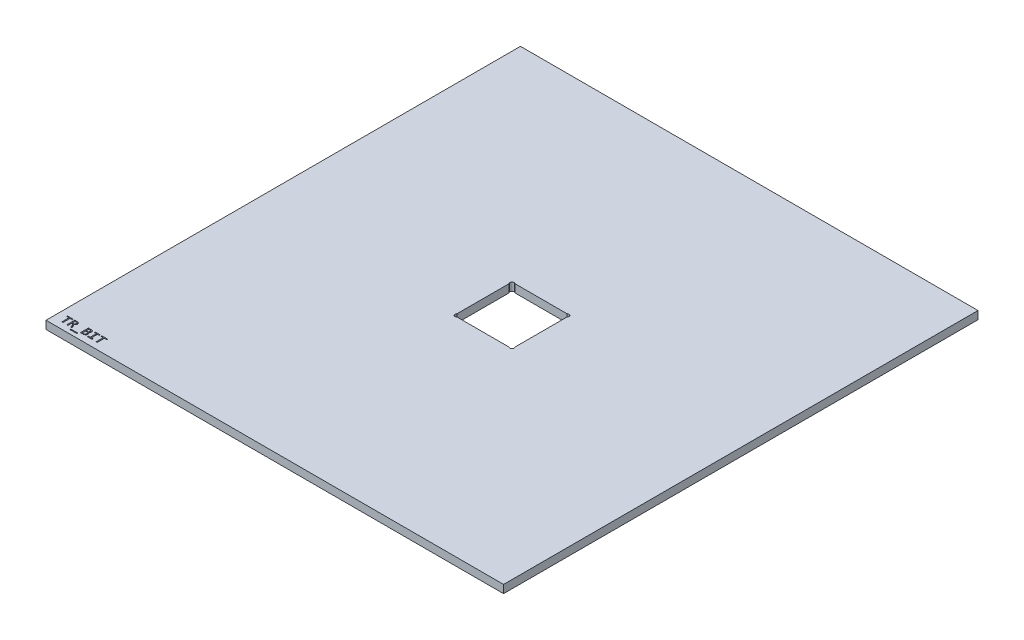
from build123d import *

# Parameters (mm, degrees)
SKETCH1_W           = 180.848
SKETCH1_H           = 187.5155
BOSS_EXTRUDE1_DEPTH = 3.175
SKETCH2_W           = 22.86
SKETCH2_H           = 22.86
CUT_EXTRUDE1_DEPTH  = 3.175
SKETCH3_R           = 0.79375
CUT_EXTRUDE2_DEPTH  = 131.296186
SKETCH4_W           = 2.714855072
SKETCH4_H           = 0.368115942
CUT_EXTRUDE3_DEPTH  = 1.5875


with BuildPart() as part:
    # Sketch1 → Boss-Extrude1 (new body)
    with BuildSketch(Plane(origin=(0, 0, 0), x_dir=(1, 0, 0), z_dir=(0, 1, 0))):
        Rectangle(SKETCH1_W, SKETCH1_H)
    extrude(amount=BOSS_EXTRUDE1_DEPTH)

    # Sketch2 → Cut-Extrude1 (cut)
    with BuildSketch(Plane(origin=(0, 3.175, 0), x_dir=(1, 0, 0), z_dir=(0, 1, 0))):
        Rectangle(SKETCH2_W, SKETCH2_H)
    extrude(amount=-CUT_EXTRUDE1_DEPTH, mode=Mode.SUBTRACT)

    # Sketch3 → Cut-Extrude2 (cut, through all)
    with BuildSketch(Plane(origin=(0, 3.175, 0), x_dir=(1, 0, 0), z_dir=(0, 1, 0))):
        with Locations((-10.868733992, 10.868733992)):
            Circle(SKETCH3_R)
        with Locations((10.868733992, 10.868733992)):
            Circle(SKETCH3_R)
        with Locations((10.868733992, -10.868733992)):
            Circle(SKETCH3_R)
        with Locations((-10.868733992, -10.868733992)):
            Circle(SKETCH3_R)
    extrude(amount=-CUT_EXTRUDE2_DEPTH, mode=Mode.SUBTRACT)

    # Sketch4 → Cut-Extrude3 (cut)
    # profile 1 of 6: a face of its own
    with BuildSketch(Plane(origin=(0, 3.175, 0), x_dir=(1, 0, 0), z_dir=(0, 1, 0))):
        Polygon((-85.353202899, -88.410865942), (-86.273492754, -88.410865942), (-86.273492754, -91.21775), (-86.733637681, -91.21775), (-86.733637681, -88.410865942), (-87.653927536, -88.410865942), (-87.653927536, -88.04275), (-85.353202899, -88.04275), align=None)
    # profile 2 of 6: a face of its own
    with BuildSketch(Plane(origin=(0, 3.175, 0), x_dir=(1, 0, 0), z_dir=(0, 1, 0))):
        with BuildLine():
            Line((-82.638347826, -91.21775), (-83.125813859, -91.21775))
            Line((-83.125813859, -91.21775), (-83.582363904, -90.226281476))
            add(Edge.make_bspline(
                [(-83.582363904, -90.226281476), (-83.598860974, -90.191130284), (-83.629465089, -90.125920458), (-83.683350175, -90.040294449), (-83.73916016, -89.971305876), (-83.799615044, -89.918268069), (-83.865569382, -89.879574558), (-83.937441008, -89.854540538), (-84.016272547, -89.839988328), (-84.071201483, -89.838235213), (-84.100026947, -89.837315217)],
                knots=[0, 0, 0, 0, 1.339134837, 2.484261414, 3.482991323, 4.391871607, 5.244507385, 6.105289549, 7.005698766, 8, 8, 8, 8], degree=3))
            Line((-84.100026947, -89.837315217), (-84.294869565, -89.837315217))
            Line((-84.294869565, -89.837315217), (-84.294869565, -91.21775))
            Line((-84.294869565, -91.21775), (-84.755014493, -91.21775))
            Line((-84.755014493, -91.21775), (-84.755014493, -88.04275))
            Line((-84.755014493, -88.04275), (-83.910936141, -88.04275))
            add(Edge.make_bspline(
                [(-83.910936141, -88.04275), (-83.866571096, -88.043324801), (-83.781034279, -88.044433032), (-83.657527264, -88.056115686), (-83.543677978, -88.074962175), (-83.439661951, -88.102534986), (-83.344774287, -88.136226928), (-83.258689811, -88.176489474), (-83.181396775, -88.223089264), (-83.113190469, -88.276260019), (-83.052893824, -88.334285294), (-83.002293397, -88.399280748), (-82.959385051, -88.469287391), (-82.925710385, -88.545372647), (-82.900177177, -88.626034235), (-82.88111807, -88.710889782), (-82.870477515, -88.800037309), (-82.869113537, -88.860918232), (-82.86842029, -88.891861187)],
                knots=[0, 0, 0, 0, 1.390037284, 2.680023546, 3.883960013, 5.002565466, 6.047913656, 7.03574216, 7.976084698, 8.870016629, 9.741095147, 10.591561451, 11.444313202, 12.308368875, 13.191986167, 14.092206828, 15.030357037, 16, 16, 16, 16], degree=3))
            add(Edge.make_bspline(
                [(-82.86842029, -88.891861187), (-82.868994868, -88.916809205), (-82.870124847, -88.965872567), (-82.878430329, -89.038414802), (-82.89100624, -89.108963136), (-82.909849703, -89.177190844), (-82.933612198, -89.242831971), (-82.962310371, -89.305834559), (-82.997136135, -89.36550299), (-83.036557213, -89.422458811), (-83.081411438, -89.475782218), (-83.130948802, -89.525652899), (-83.18635394, -89.570899919), (-83.245486917, -89.613413484), (-83.309965112, -89.651029424), (-83.379136935, -89.683170015), (-83.452650391, -89.710818718), (-83.503864807, -89.724616993), (-83.529878623, -89.731625679)],
                knots=[0, 0, 0, 0, 1.032708305, 2.030948508, 3.019625047, 3.996933367, 4.957424013, 5.907556856, 6.85893238, 7.814077788, 8.77200233, 9.740252168, 10.719774328, 11.730219428, 12.753012585, 13.805036997, 14.885091985, 16, 16, 16, 16], degree=3))
            add(Edge.make_bspline(
                [(-83.529878623, -89.731625679), (-83.508734767, -89.739380778), (-83.466783942, -89.754767413), (-83.409104807, -89.789031767), (-83.354855427, -89.828859176), (-83.307413111, -89.879758478), (-83.261027139, -89.937088784), (-83.215047309, -90.003148469), (-83.168355492, -90.077696238), (-83.138952467, -90.131452504), (-83.123656929, -90.159416667)],
                knots=[0, 0, 0, 0, 0.890820497, 1.767447404, 2.649001527, 3.549193506, 4.515009134, 5.571837998, 6.736863216, 8, 8, 8, 8], degree=3))
            Line((-83.123656929, -90.159416667), (-82.638347826, -91.21775))
        make_face()
        with BuildLine():
            add(Edge.make_bspline(
                [(-83.328565217, -88.922777174), (-83.328901843, -88.901906114), (-83.32955407, -88.861467484), (-83.336773162, -88.802931226), (-83.34912625, -88.74858325), (-83.365581675, -88.698221992), (-83.386140981, -88.651372969), (-83.413407518, -88.609650848), (-83.444183923, -88.571263632), (-83.479733549, -88.537216471), (-83.519769509, -88.507597987), (-83.563758214, -88.481855754), (-83.611291845, -88.459414038), (-83.662835579, -88.441302724), (-83.718322956, -88.428061778), (-83.777599298, -88.41773837), (-83.840852671, -88.41224996), (-83.884324813, -88.411335157), (-83.906622283, -88.410865942)],
                knots=[0, 0, 0, 0, 1.136086502, 2.201219443, 3.204852043, 4.166451082, 5.083443327, 5.98129036, 6.87199526, 7.758098985, 8.653381414, 9.577773354, 10.529401831, 11.511765708, 12.546811162, 13.632454437, 14.78565276, 16, 16, 16, 16], degree=3))
            Line((-83.906622283, -88.410865942), (-84.294869565, -88.410865942))
            Line((-84.294869565, -88.410865942), (-84.294869565, -89.469199275))
            Line((-84.294869565, -89.469199275), (-83.961983469, -89.469199275))
            add(Edge.make_bspline(
                [(-83.961983469, -89.469199275), (-83.93824743, -89.468775061), (-83.891881464, -89.467946402), (-83.824245057, -89.461800526), (-83.760525642, -89.449675605), (-83.700090994, -89.435336816), (-83.643820366, -89.415000628), (-83.592001738, -89.390397511), (-83.543763099, -89.362541635), (-83.500833591, -89.329095915), (-83.461473321, -89.292318472), (-83.427024794, -89.251260372), (-83.397057325, -89.206291797), (-83.372862702, -89.156799379), (-83.3522013, -89.103890377), (-83.339197548, -89.046440031), (-83.330033673, -88.985862033), (-83.329062587, -88.944144192), (-83.328565217, -88.922777174)],
                knots=[0, 0, 0, 0, 1.202615583, 2.349188572, 3.435207305, 4.486530095, 5.492783739, 6.45958443, 7.390413995, 8.308405015, 9.210274755, 10.115082188, 11.017605575, 11.940721498, 12.901403136, 13.887978084, 14.918265918, 16, 16, 16, 16], degree=3))
        make_face(mode=Mode.SUBTRACT)
    # profile 3 of 6: a face of its own
    with BuildSketch(Plane(origin=(0, 3.175, 0), x_dir=(1, 0, 0), z_dir=(0, 1, 0))):
        with Locations((-81.096862319, -92.04601087)):
            Rectangle(SKETCH4_W, SKETCH4_H)
    # profile 4 of 6: a face of its own
    with BuildSketch(Plane(origin=(0, 3.175, 0), x_dir=(1, 0, 0), z_dir=(0, 1, 0))):
        with BuildLine():
            add(Edge.make_bspline(
                [(-77.300666667, -90.256478487), (-77.301767408, -90.293929266), (-77.303916628, -90.367052676), (-77.320759558, -90.473189263), (-77.348005833, -90.573001284), (-77.38692422, -90.665931999), (-77.43648218, -90.751801926), (-77.493981353, -90.831853883), (-77.562241143, -90.903949147), (-77.6396186, -90.968793102), (-77.725718864, -91.026528496), (-77.820300053, -91.076706576), (-77.923229564, -91.120132703), (-78.034429642, -91.155730594), (-78.15300213, -91.183451777), (-78.278120993, -91.203821947), (-78.409843128, -91.214989694), (-78.49989964, -91.216816295), (-78.545933877, -91.21775)],
                knots=[0, 0, 0, 0, 1.013216857, 1.978326566, 2.900521816, 3.80762901, 4.696652207, 5.578905641, 6.469134838, 7.376056482, 8.306156408, 9.269586241, 10.269510869, 11.325927403, 12.425683058, 13.562442612, 14.753992443, 16, 16, 16, 16], degree=3))
            Line((-78.545933877, -91.21775), (-79.371318841, -91.21775))
            Line((-79.371318841, -91.21775), (-79.371318841, -88.04275))
            Line((-79.371318841, -88.04275), (-78.458937726, -88.04275))
            add(Edge.make_bspline(
                [(-78.458937726, -88.04275), (-78.415776923, -88.043171305), (-78.332222251, -88.043986906), (-78.211327188, -88.05393778), (-78.098609009, -88.067679445), (-77.994182637, -88.088203549), (-77.898285108, -88.115948787), (-77.809991763, -88.147610533), (-77.730514356, -88.186599133), (-77.659442607, -88.23147315), (-77.596067661, -88.28174973), (-77.541935424, -88.339261014), (-77.495367382, -88.402028876), (-77.457743947, -88.471343702), (-77.428163159, -88.546400313), (-77.407445232, -88.627549956), (-77.395186792, -88.714378614), (-77.393541304, -88.774148172), (-77.392695652, -88.804865036)],
                knots=[0, 0, 0, 0, 1.388776146, 2.688521212, 3.90167895, 5.042289038, 6.109239049, 7.11226345, 8.057476407, 8.951978552, 9.813306123, 10.653548746, 11.486644475, 12.322022467, 13.184316581, 14.076721024, 15.011585489, 16, 16, 16, 16], degree=3))
            add(Edge.make_bspline(
                [(-77.392695652, -88.804865036), (-77.394187829, -88.845716953), (-77.397092057, -88.925227163), (-77.420465455, -89.040231165), (-77.459482567, -89.146199347), (-77.504703675, -89.227097931), (-77.548888272, -89.286037834), (-77.587262923, -89.327182959), (-77.63058913, -89.365156859), (-77.678325997, -89.400685977), (-77.731080807, -89.433021183), (-77.788816355, -89.462453202), (-77.851312239, -89.489051092), (-77.895156559, -89.503989589), (-77.91754846, -89.511618886)],
                knots=[0, 0, 0, 0, 1.542514348, 3.00220039, 4.41170875, 5.794260582, 6.486040375, 7.190794555, 7.915677968, 8.659981338, 9.436469499, 10.250434215, 11.106472525, 12, 12, 12, 12], degree=3))
            add(Edge.make_bspline(
                [(-77.91754846, -89.511618886), (-77.87664368, -89.52138252), (-77.794952297, -89.540881581), (-77.69877587, -89.584147488), (-77.626119669, -89.625464199), (-77.575453465, -89.662078725), (-77.52784107, -89.702208006), (-77.483872937, -89.7470422), (-77.44350785, -89.795968992), (-77.407265864, -89.849224875), (-77.376677228, -89.907458977), (-77.348810265, -89.96901986), (-77.327568021, -90.035403794), (-77.311528408, -90.105578127), (-77.302101832, -90.179769245), (-77.30115142, -90.230568553), (-77.300666667, -90.256478487)],
                knots=[0, 0, 0, 0, 1.670885493, 3.336943679, 4.174711656, 4.995358125, 5.821090152, 6.65083528, 7.491206374, 8.34319308, 9.209637874, 10.10658404, 11.029731221, 11.978595832, 12.968992875, 14, 14, 14, 14], degree=3))
        make_face()
        with BuildLine():
            add(Edge.make_bspline(
                [(-77.85284058, -88.864540082), (-77.854161122, -88.833734621), (-77.856753897, -88.773250649), (-77.875402457, -88.700093166), (-77.897242037, -88.645331886), (-77.919347424, -88.60738698), (-77.947588932, -88.572860108), (-77.980772524, -88.541382551), (-78.019214895, -88.512019396), (-78.064494712, -88.487086054), (-78.115808229, -88.464860097), (-78.173491667, -88.445492372), (-78.238113978, -88.42957659), (-78.31047592, -88.41815795), (-78.390767081, -88.41204341), (-78.446944803, -88.411269086), (-78.476193161, -88.410865942)],
                knots=[0, 0, 0, 0, 1.467350645, 2.88102155, 3.572915596, 4.274650825, 4.965411238, 5.692918483, 6.45179769, 7.26549663, 8.150919223, 9.115896111, 10.16367939, 11.321101063, 12.605258578, 14, 14, 14, 14], degree=3))
            Line((-78.476193161, -88.410865942), (-78.911173913, -88.410865942))
            Line((-78.911173913, -88.410865942), (-78.911173913, -89.37717029))
            Line((-78.911173913, -89.37717029), (-78.49057269, -89.37717029))
            add(Edge.make_bspline(
                [(-78.49057269, -89.37717029), (-78.444696492, -89.375694942), (-78.356911508, -89.372871835), (-78.250692628, -89.35378391), (-78.173249825, -89.331332692), (-78.121468475, -89.308054353), (-78.072480474, -89.283616777), (-78.028835265, -89.252923081), (-77.988728878, -89.219097156), (-77.953534545, -89.180905973), (-77.92287595, -89.138813833), (-77.897680681, -89.092359062), (-77.877342165, -89.041771711), (-77.863140955, -88.986682116), (-77.854316788, -88.927136465), (-77.853344367, -88.885902411), (-77.85284058, -88.864540082)],
                knots=[0, 0, 0, 0, 2.073538655, 3.967755928, 4.862618563, 5.712230629, 6.531505899, 7.334196252, 8.118305519, 8.900614993, 9.67674368, 10.467342855, 11.284464589, 12.136217, 13.034420764, 14, 14, 14, 14], degree=3))
        make_face(mode=Mode.SUBTRACT)
        with BuildLine():
            add(Edge.make_bspline(
                [(-77.760811594, -90.273014946), (-77.761288763, -90.253085269), (-77.762225678, -90.213953551), (-77.771847595, -90.156726005), (-77.78761894, -90.102682223), (-77.809520058, -90.051850198), (-77.836570675, -90.004209361), (-77.870248318, -89.960957686), (-77.90863738, -89.92069802), (-77.953307965, -89.885006521), (-78.00326612, -89.853546666), (-78.057735842, -89.825120785), (-78.117411303, -89.80079497), (-78.182173689, -89.780869375), (-78.251622709, -89.764982077), (-78.325406869, -89.753843571), (-78.403656965, -89.746206424), (-78.457240624, -89.745598922), (-78.484820879, -89.745286232)],
                knots=[0, 0, 0, 0, 0.948445084, 1.862262358, 2.754366203, 3.623615494, 4.492864785, 5.355796555, 6.227589923, 7.136690505, 8.070741307, 9.035595869, 10.059344591, 11.135152229, 12.259281394, 13.44900263, 14.686966176, 16, 16, 16, 16], degree=3))
            Line((-78.484820879, -89.745286232), (-78.911173913, -89.745286232))
            Line((-78.911173913, -89.745286232), (-78.911173913, -90.849634058))
            Line((-78.911173913, -90.849634058), (-78.47044135, -90.849634058))
            add(Edge.make_bspline(
                [(-78.47044135, -90.849634058), (-78.441427747, -90.849264013), (-78.385480287, -90.848550449), (-78.304349458, -90.84185132), (-78.228786402, -90.831613893), (-78.159194988, -90.815617802), (-78.095172075, -90.79622008), (-78.036524019, -90.772887579), (-77.984110327, -90.74375948), (-77.936450768, -90.711542959), (-77.895152566, -90.673498072), (-77.858799326, -90.63098716), (-77.828566956, -90.582834844), (-77.803342481, -90.530299179), (-77.783834378, -90.472855434), (-77.770317732, -90.410634095), (-77.762520159, -90.343433535), (-77.761393583, -90.297001648), (-77.760811594, -90.273014946)],
                knots=[0, 0, 0, 0, 1.326701194, 2.558302104, 3.720902774, 4.811133236, 5.820090824, 6.778795896, 7.691204955, 8.557756331, 9.403467856, 10.251165954, 11.10865784, 11.996033528, 12.91113804, 13.8765245, 14.903013039, 16, 16, 16, 16], degree=3))
        make_face(mode=Mode.SUBTRACT)
    # profile 5 of 6: a face of its own
    with BuildSketch(Plane(origin=(0, 3.175, 0), x_dir=(1, 0, 0), z_dir=(0, 1, 0))):
        Polygon((-75.874217391, -88.410865942), (-76.610449275, -88.410865942), (-76.610449275, -88.04275), (-74.67784058, -88.04275), (-74.67784058, -88.410865942), (-75.414072464, -88.410865942), (-75.414072464, -90.849634058), (-74.67784058, -90.849634058), (-74.67784058, -91.21775), (-76.610449275, -91.21775), (-76.610449275, -90.849634058), (-75.874217391, -90.849634058), align=None)
    # profile 6 of 6: a face of its own
    with BuildSketch(Plane(origin=(0, 3.175, 0), x_dir=(1, 0, 0), z_dir=(0, 1, 0))):
        Polygon((-71.778927536, -88.410865942), (-72.699217391, -88.410865942), (-72.699217391, -91.21775), (-73.159362319, -91.21775), (-73.159362319, -88.410865942), (-74.079652174, -88.410865942), (-74.079652174, -88.04275), (-71.778927536, -88.04275), align=None)
    extrude(amount=-CUT_EXTRUDE3_DEPTH, mode=Mode.SUBTRACT)


solid = part.part
